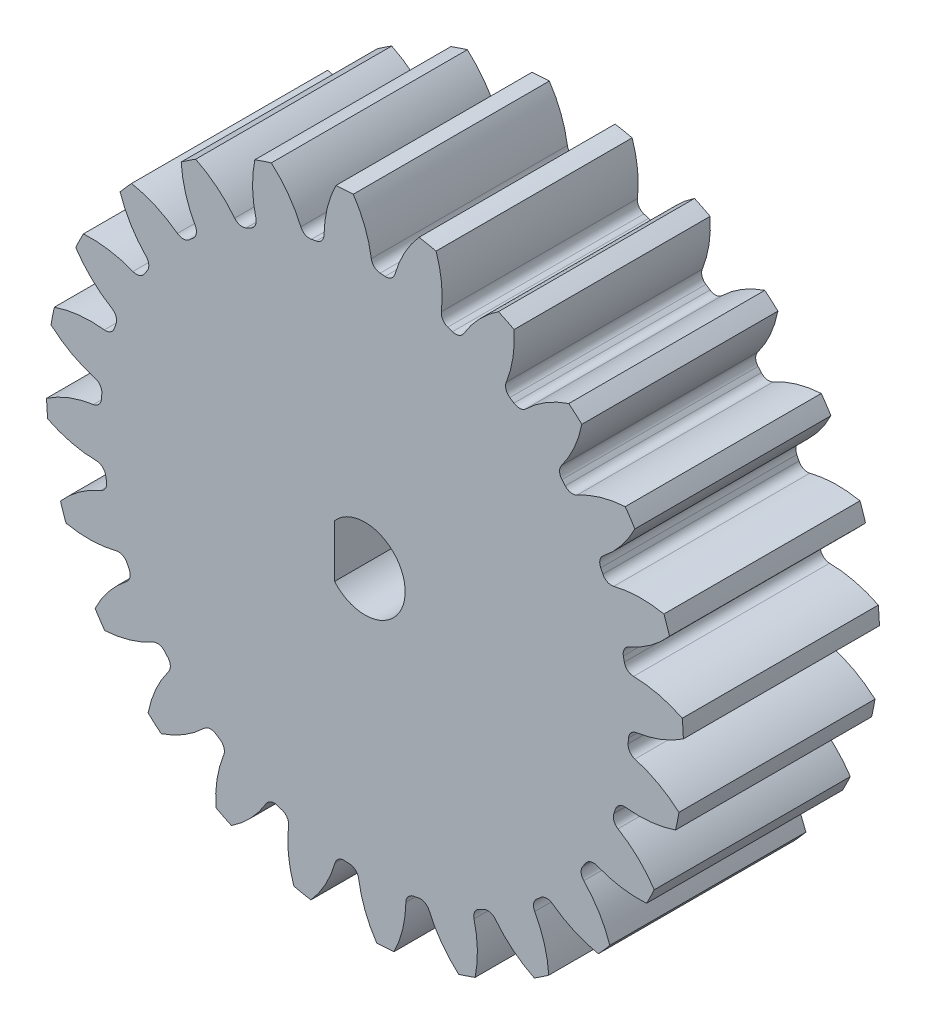
from build123d import *

# Parameters (mm, degrees)
SKETCH3_R          = 20.6375
GEARBODY_DEPTH     = 12.7
TOOTHCUT_DEPTH     = 32.829276029
CIRPATTERN1_COUNT  = 24
CUT_EXTRUDE1_DEPTH = 32.811300403


with BuildPart() as part:
    # Sketch3 → gearBody (new body)
    with BuildSketch(Plane.XY):
        Circle(SKETCH3_R)
    extrude(amount=GEARBODY_DEPTH)

    # Sketch2 → toothCut (cut, through all)
    with BuildSketch(Plane.XY):
        with BuildLine():
            ThreePointArc((17.04439181, -1.303986765), (17.05590718, -1.14354882), (17.065912391, -0.983009622))
            ThreePointArc((17.065912391, -0.983009622), (17.226475942, -0.603092534), (17.591114308, -0.410332293))
            ThreePointArc((17.591114308, -0.410332293), (20.42378314, 0.626979823), (22.599606758, 2.716434472))
            ThreePointArc((22.599606758, 2.716434472), (22.711286815, -1.522725526), (22.034703624, -5.709034773))
            ThreePointArc((22.034703624, -5.709034773), (20.157284273, -3.347822008), (17.488443939, -1.941649751))
            ThreePointArc((17.488443939, -1.941649751), (17.152801577, -1.701937731), (17.04439181, -1.303986765))
        make_face()
    toothcut = extrude(amount=TOOTHCUT_DEPTH, mode=Mode.SUBTRACT)

    # CirPattern1: toothCut ×24 about axis
    cirpattern1_axis = Axis((0, 0, 12.7), (0, 0, -1))
    for i in range(1, CIRPATTERN1_COUNT):
        add(toothcut.rotate(cirpattern1_axis, i * 360 / CIRPATTERN1_COUNT), mode=Mode.SUBTRACT)

    # Sketch4 → Cut-Extrude1 (cut, through all)
    with BuildSketch(Plane(origin=(0, 0, 0), x_dir=(-1, 0, 0), z_dir=(0, 0, -1))):
        with BuildLine():
            Line((1.9685, -1.703883799), (1.9685, 1.703883799))
            ThreePointArc((1.9685, 1.703883799), (-2.6035, 0), (1.9685, -1.703883799))
        make_face()
    extrude(amount=-CUT_EXTRUDE1_DEPTH, mode=Mode.SUBTRACT)


solid = part.part
